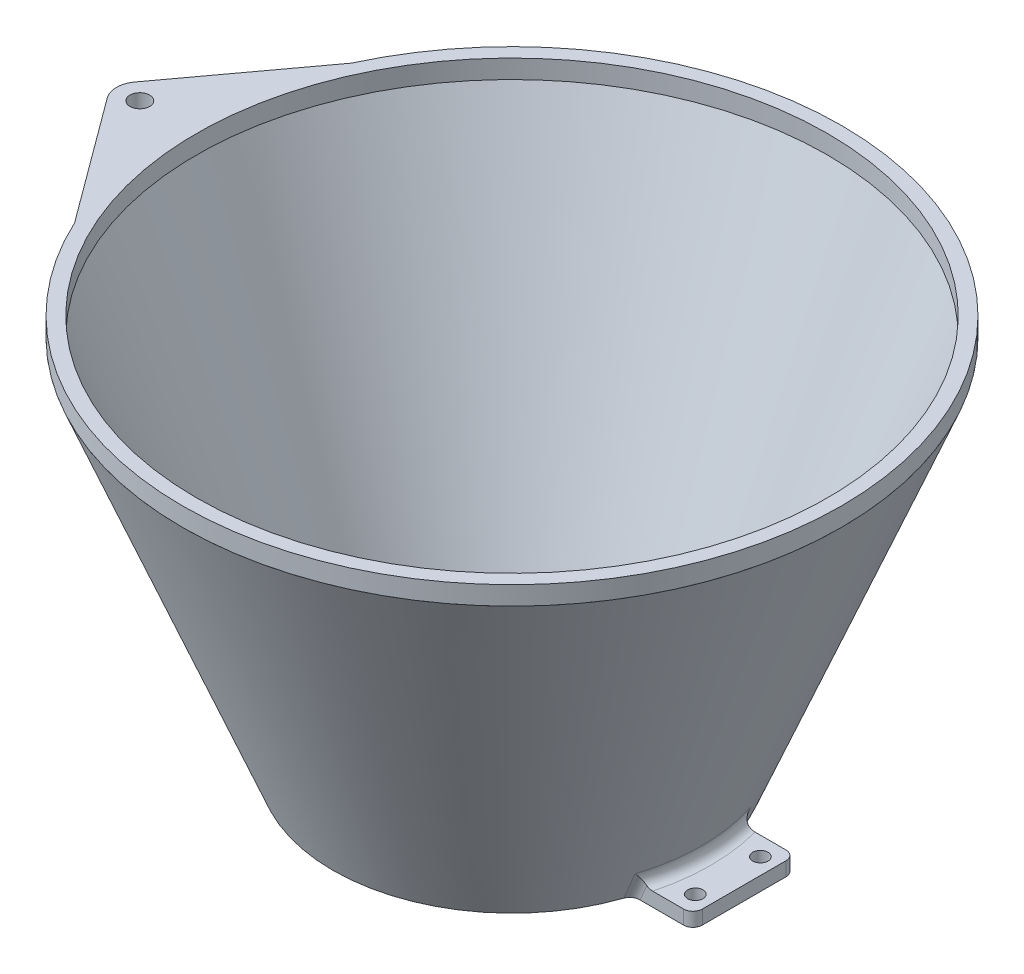
from build123d import *

# Parameters (mm, degrees)
SKETCH3_R           = 1.65
BOSS_EXTRUDE1_DEPTH = 3
FILLET1_R           = 2
SKETCH4_R           = 2.125
SKETCH4_R_2         = 67.822098067
BOSS_EXTRUDE2_DEPTH = 4


with BuildPart() as part:
    # Sketch2 → Revolve1 (revolve)
    with BuildSketch(Plane.XY):
        Polygon((35.5, 0), (67.822098067, 80), (70.822098067, 80), (38.5, 0), align=None)
    revolve(axis=Axis((0, 0, 0), (0, 1, 0)))

    # Sketch3 → Boss-Extrude1 (add)
    # profile 1 of 2: a face of its own
    with BuildSketch(Plane.XZ):
        with BuildLine():
            Line((-49.895121629, 11), (-36.895121629, 11))
            ThreePointArc((-36.895121629, 11), (-38.5, 0), (-36.895121629, -11))
            Line((-36.895121629, -11), (-49.895121629, -11))
            Line((-49.895121629, -11), (-49.895121629, 11))
        make_face()
        with Locations((-46.395121629, -7)):
            Circle(SKETCH3_R, mode=Mode.SUBTRACT)
        with Locations((-46.395121629, 7)):
            Circle(SKETCH3_R, mode=Mode.SUBTRACT)
    # profile 2 of 2: a face of its own
    with BuildSketch(Plane.XZ):
        with BuildLine():
            Line((49.895121629, -11), (36.895121629, -11))
            ThreePointArc((36.895121629, -11), (38.5, 0), (36.895121629, 11))
            Line((36.895121629, 11), (49.895121629, 11))
            Line((49.895121629, 11), (49.895121629, -11))
        make_face()
        with Locations((46.395121629, 7)):
            Circle(SKETCH3_R, mode=Mode.SUBTRACT)
        with Locations((46.395121629, -7)):
            Circle(SKETCH3_R, mode=Mode.SUBTRACT)
    extrude(amount=-BOSS_EXTRUDE1_DEPTH)

    # Fillet1
    fillet1_edges = [part.edges().sort_by_distance(p)[0] for p in [
        (37.527024392, 1.499849586, -11),
        (49.895121629, 1.5, -11),
        (49.895121629, 1.5, 11),
        (37.527024392, 1.499849586, 11),
        (-37.527024392, 1.499849586, 11),
        (-49.895121629, 1.5, 11),
        (-49.895121629, 1.5, -11),
        (-37.527024392, 1.499849586, -11),
        (39.321693351, 3, -5.554603938),
        (-39.712078678, 3, 0),
    ]]
    fillet(fillet1_edges, radius=FILLET1_R)


with BuildPart() as body_2:
    # Sketch4 → Boss-Extrude2 (new body)
    with BuildSketch(Plane(origin=(0, 80, 0), x_dir=(1, 0, 0), z_dir=(0, 1, 0))):
        with BuildLine():
            Line((-64.279201496, 29.731361045), (-84.023539016, 2.968355401))
            ThreePointArc((-84.023539016, 2.968355401), (-85, 0), (-84.023539016, -2.968355401))
            Line((-84.023539016, -2.968355401), (-64.279201496, -29.731361045))
            ThreePointArc((-64.279201496, -29.731361045), (70.822098067, 0), (-64.279201496, 29.731361045))
        make_face()
        with Locations((-80, 0)):
            Circle(SKETCH4_R, mode=Mode.SUBTRACT)
        Circle(SKETCH4_R_2, mode=Mode.SUBTRACT)
    extrude(amount=BOSS_EXTRUDE2_DEPTH)


solid = Compound([part.part, body_2.part])
